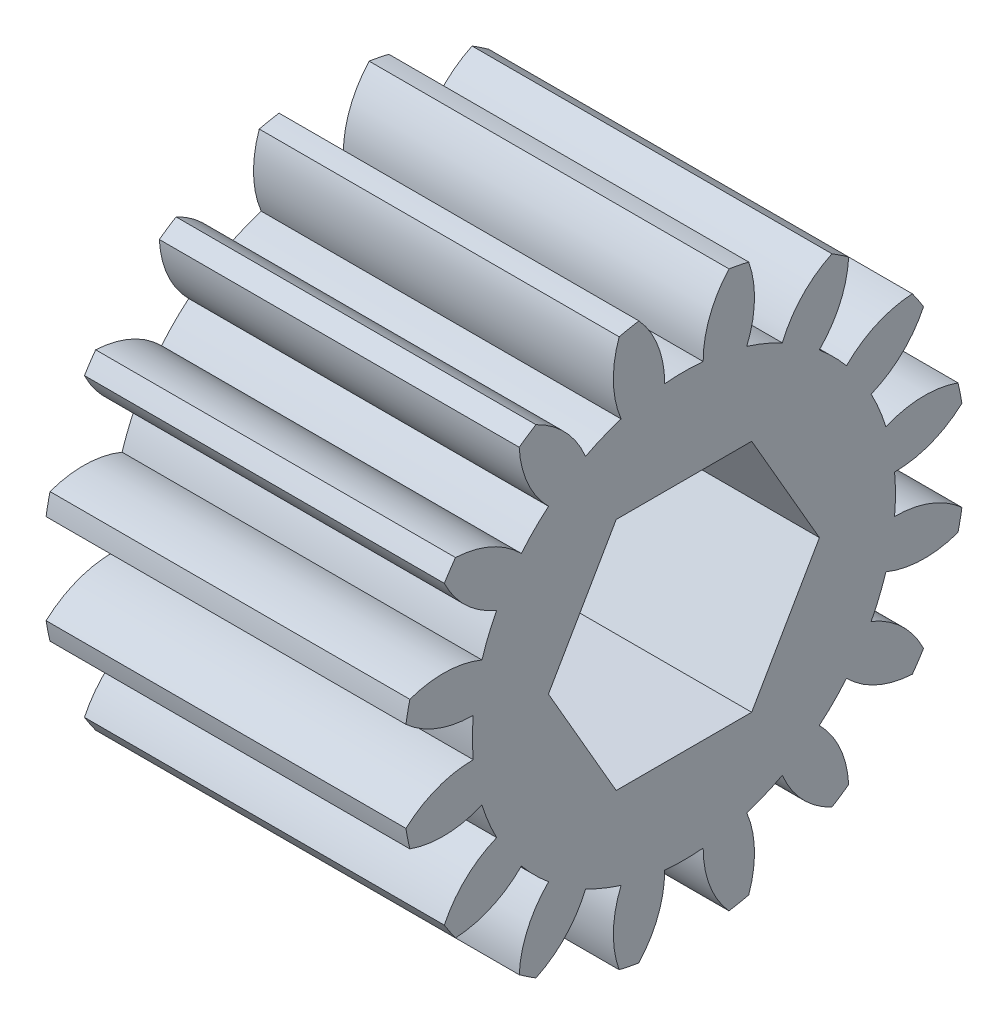
from build123d import *

# Parameters (mm, degrees)
SPUR_START             = -44.074195703
SPUR_GEAR_AI_OUTLINE_R = 4.7625
SPUR_GEAR_AI_DEPTH     = 14.605
CUT_EXTRUDE1_DEPTH     = 39.307434666


# Read off the part's stored shape, not the designer's step: spur gear_ai
with BuildPart() as part:
    # spur gear_ai outline → spur gear_ai (new body)
    with BuildSketch(Plane.YZ.offset(SPUR_START)):
        with BuildLine():
            ThreePointArc((12.686684526, 14.250652999), (12.919777657, 14.586350288), (13.140720632, 14.930166051))
            ThreePointArc((13.140720632, 14.930166051), (12.265878987, 16.134593199), (11.016013995, 16.943190851))
            ThreePointArc((11.016013995, 16.943190851), (11.347770551, 17.651104248), (11.613753604, 18.386261921))
            ThreePointArc((11.613753604, 18.386261921), (13.069306498, 18.074238793), (14.539571561, 18.307290937))
            ThreePointArc((14.539571561, 18.307290937), (14.626455743, 18.70663567), (14.699007839, 19.108831233))
            ThreePointArc((14.699007839, 19.108831233), (13.429845234, 19.88678942), (11.965683625, 20.155533616))
            ThreePointArc((11.965683625, 20.155533616), (12.001279988, 20.936518051), (11.965683625, 21.717502486))
            ThreePointArc((11.965683625, 21.717502486), (13.429845234, 21.986246682), (14.699007839, 22.764204869))
            ThreePointArc((14.699007839, 22.764204869), (14.626455743, 23.166400432), (14.539571561, 23.565745165))
            ThreePointArc((14.539571561, 23.565745165), (13.069306498, 23.79879731), (11.613753604, 23.486774182))
            ThreePointArc((11.613753604, 23.486774182), (11.347770551, 24.221931855), (11.016013995, 24.929845251))
            ThreePointArc((11.016013995, 24.929845251), (12.265878987, 25.738442903), (13.140720632, 26.942870051))
            ThreePointArc((13.140720632, 26.942870051), (12.919777657, 27.286685815), (12.686684526, 27.622383104))
            ThreePointArc((12.686684526, 27.622383104), (11.239151532, 27.275049128), (10.013802086, 26.42976137))
            ThreePointArc((10.013802086, 26.42976137), (9.486733126, 27.007171189), (8.909323306, 27.534240149))
            ThreePointArc((8.909323306, 27.534240149), (9.754611065, 28.759589595), (10.10194504, 30.207122589))
            ThreePointArc((10.10194504, 30.207122589), (9.766247751, 30.44021572), (9.422431988, 30.661158695))
            ThreePointArc((9.422431988, 30.661158695), (8.21800484, 29.78631705), (7.409407188, 28.536452058))
            ThreePointArc((7.409407188, 28.536452058), (6.701493792, 28.868208614), (5.966336119, 29.134191667))
            ThreePointArc((5.966336119, 29.134191667), (6.278359246, 30.589744561), (6.045307102, 32.060009624))
            ThreePointArc((6.045307102, 32.060009624), (5.645962369, 32.146893806), (5.243766806, 32.219445902))
            ThreePointArc((5.243766806, 32.219445902), (4.465808619, 30.950283297), (4.197064423, 29.486121688))
            ThreePointArc((4.197064423, 29.486121688), (3.416079988, 29.521718051), (2.635095553, 29.486121688))
            ThreePointArc((2.635095553, 29.486121688), (2.366351357, 30.950283297), (1.58839317, 32.219445902))
            ThreePointArc((1.58839317, 32.219445902), (1.186197607, 32.146893806), (0.786852874, 32.060009624))
            ThreePointArc((0.786852874, 32.060009624), (0.55380073, 30.589744561), (0.865823857, 29.134191667))
            ThreePointArc((0.865823857, 29.134191667), (0.130666184, 28.868208614), (-0.577247212, 28.536452058))
            ThreePointArc((-0.577247212, 28.536452058), (-1.385844864, 29.78631705), (-2.590272012, 30.661158695))
            ThreePointArc((-2.590272012, 30.661158695), (-2.934087775, 30.44021572), (-3.269785064, 30.207122589))
            ThreePointArc((-3.269785064, 30.207122589), (-2.922451089, 28.759589595), (-2.07716333, 27.534240149))
            ThreePointArc((-2.07716333, 27.534240149), (-2.65457315, 27.007171189), (-3.18164211, 26.42976137))
            ThreePointArc((-3.18164211, 26.42976137), (-4.406991556, 27.275049128), (-5.85452455, 27.622383104))
            ThreePointArc((-5.85452455, 27.622383104), (-6.087617681, 27.286685815), (-6.308560656, 26.942870051))
            ThreePointArc((-6.308560656, 26.942870051), (-5.43371901, 25.738442903), (-4.183854019, 24.929845251))
            ThreePointArc((-4.183854019, 24.929845251), (-4.515610574, 24.221931855), (-4.781593628, 23.486774182))
            ThreePointArc((-4.781593628, 23.486774182), (-6.237146522, 23.79879731), (-7.707411585, 23.565745165))
            ThreePointArc((-7.707411585, 23.565745165), (-7.794295767, 23.166400432), (-7.866847863, 22.764204869))
            ThreePointArc((-7.866847863, 22.764204869), (-6.597685258, 21.986246682), (-5.133523649, 21.717502486))
            ThreePointArc((-5.133523649, 21.717502486), (-5.169120012, 20.936518051), (-5.133523649, 20.155533616))
            ThreePointArc((-5.133523649, 20.155533616), (-6.597685258, 19.88678942), (-7.866847863, 19.108831233))
            ThreePointArc((-7.866847863, 19.108831233), (-7.794295767, 18.70663567), (-7.707411585, 18.307290937))
            ThreePointArc((-7.707411585, 18.307290937), (-6.237146522, 18.074238793), (-4.781593628, 18.386261921))
            ThreePointArc((-4.781593628, 18.386261921), (-4.515610574, 17.651104248), (-4.183854019, 16.943190851))
            ThreePointArc((-4.183854019, 16.943190851), (-5.43371901, 16.134593199), (-6.308560656, 14.930166051))
            ThreePointArc((-6.308560656, 14.930166051), (-6.087617681, 14.586350288), (-5.85452455, 14.250652999))
            ThreePointArc((-5.85452455, 14.250652999), (-4.406991556, 14.597986974), (-3.18164211, 15.443274733))
            ThreePointArc((-3.18164211, 15.443274733), (-2.65457315, 14.865864913), (-2.07716333, 14.338795953))
            ThreePointArc((-2.07716333, 14.338795953), (-2.922451089, 13.113446507), (-3.269785064, 11.665913513))
            ThreePointArc((-3.269785064, 11.665913513), (-2.934087775, 11.432820383), (-2.590272012, 11.211877407))
            ThreePointArc((-2.590272012, 11.211877407), (-1.385844864, 12.086719053), (-0.577247212, 13.336584044))
            ThreePointArc((-0.577247212, 13.336584044), (0.130666184, 13.004827489), (0.865823857, 12.738844436))
            ThreePointArc((0.865823857, 12.738844436), (0.55380073, 11.283291542), (0.786852874, 9.813026478))
            ThreePointArc((0.786852874, 9.813026478), (1.186197607, 9.726142296), (1.58839317, 9.6535902))
            ThreePointArc((1.58839317, 9.6535902), (2.366351357, 10.922752805), (2.635095553, 12.386914414))
            ThreePointArc((2.635095553, 12.386914414), (3.416079988, 12.351318051), (4.197064423, 12.386914414))
            ThreePointArc((4.197064423, 12.386914414), (4.465808619, 10.922752805), (5.243766806, 9.6535902))
            ThreePointArc((5.243766806, 9.6535902), (5.645962369, 9.726142296), (6.045307102, 9.813026478))
            ThreePointArc((6.045307102, 9.813026478), (6.278359246, 11.283291542), (5.966336119, 12.738844436))
            ThreePointArc((5.966336119, 12.738844436), (6.701493792, 13.004827489), (7.409407188, 13.336584044))
            ThreePointArc((7.409407188, 13.336584044), (8.21800484, 12.086719053), (9.422431988, 11.211877407))
            ThreePointArc((9.422431988, 11.211877407), (9.766247751, 11.432820383), (10.10194504, 11.665913513))
            ThreePointArc((10.10194504, 11.665913513), (9.754611065, 13.113446507), (8.909323306, 14.338795953))
            ThreePointArc((8.909323306, 14.338795953), (9.486733126, 14.865864913), (10.013802086, 15.443274733))
            ThreePointArc((10.013802086, 15.443274733), (11.239151532, 14.597986974), (12.686684526, 14.250652999))
        make_face()
        with Locations((3.416079988, 20.936518051)):
            Circle(SPUR_GEAR_AI_OUTLINE_R, mode=Mode.SUBTRACT)
    extrude(amount=SPUR_GEAR_AI_DEPTH)

    # Sketch1 → Cut-Extrude1 (cut, through all)
    with BuildSketch(Plane(origin=(-29.469195703, 0, 0), x_dir=(0, 0, -1), z_dir=(1, 0, 0))):
        Polygon((-18.186887394, 8.178579988), (-23.686148708, 8.178579988), (-26.435779365, 3.416079988), (-23.686148708, -1.346420012), (-18.186887394, -1.346420012), (-15.437256737, 3.416079988), align=None)
    extrude(amount=-CUT_EXTRUDE1_DEPTH, mode=Mode.SUBTRACT)


solid = part.part
